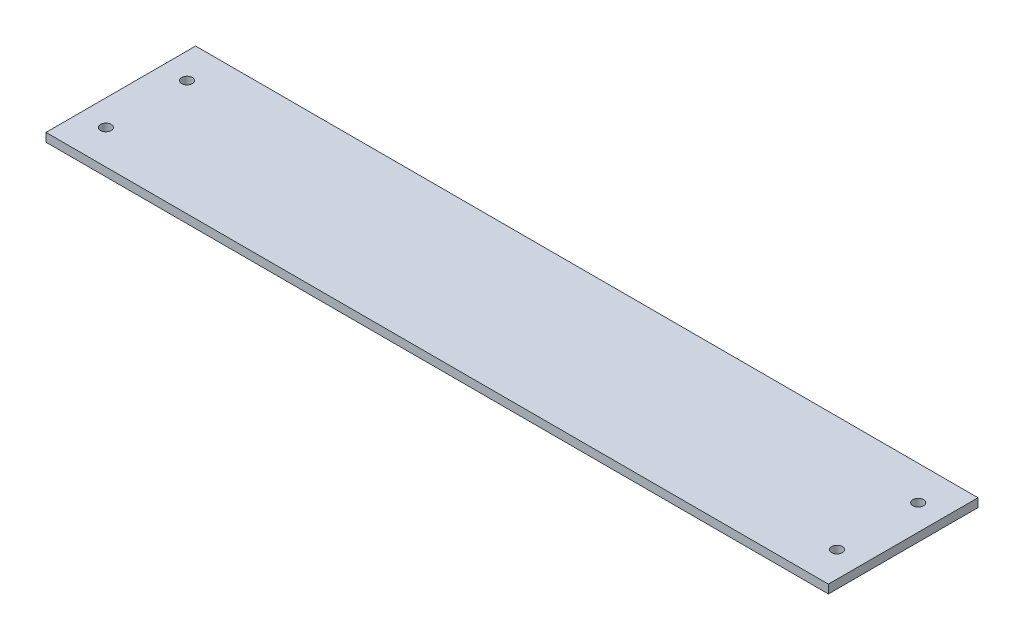
from build123d import *

# Parameters (mm, degrees)
SKETCH1_W               = 183.04
SKETCH1_H               = 35
BASE_FLANGE1_DEPTH      = 2
TAP_DRILL_FOR_M3_TAP1_D = 2.5
TAP_DRILL_FOR_M3_TAP2_D = 2.5


# Sheet-metal steps are written as plain solids
with BuildPart() as part:
    # Sketch1 → Base-Flange1 (new body)
    with BuildSketch(Plane(origin=(0, 0, 0), x_dir=(1, 0, 0), z_dir=(0, 1, 0))):
        Rectangle(SKETCH1_W, SKETCH1_H)
    extrude(amount=-BASE_FLANGE1_DEPTH)

    # Tap Drill for M3 Tap1 (through all)
    with Locations(Plane(origin=(-65.865910354, 2, 15.830402425), x_dir=(0, 0, -1), z_dir=(0, 1, 0))):
        with Locations((25.330402425, 19.654089646), (6.330402425, 19.654089646)):
            Hole(TAP_DRILL_FOR_M3_TAP1_D / 2)

    # Tap Drill for M3 Tap2 (through all)
    with Locations(Plane(origin=(-65.865910354, 2, 15.830402425), x_dir=(0, 0, -1), z_dir=(0, 1, 0))):
        with Locations((25.330402425, -151.404413252), (6.330402425, -151.404413252)):
            Hole(TAP_DRILL_FOR_M3_TAP2_D / 2)


solid = part.part
